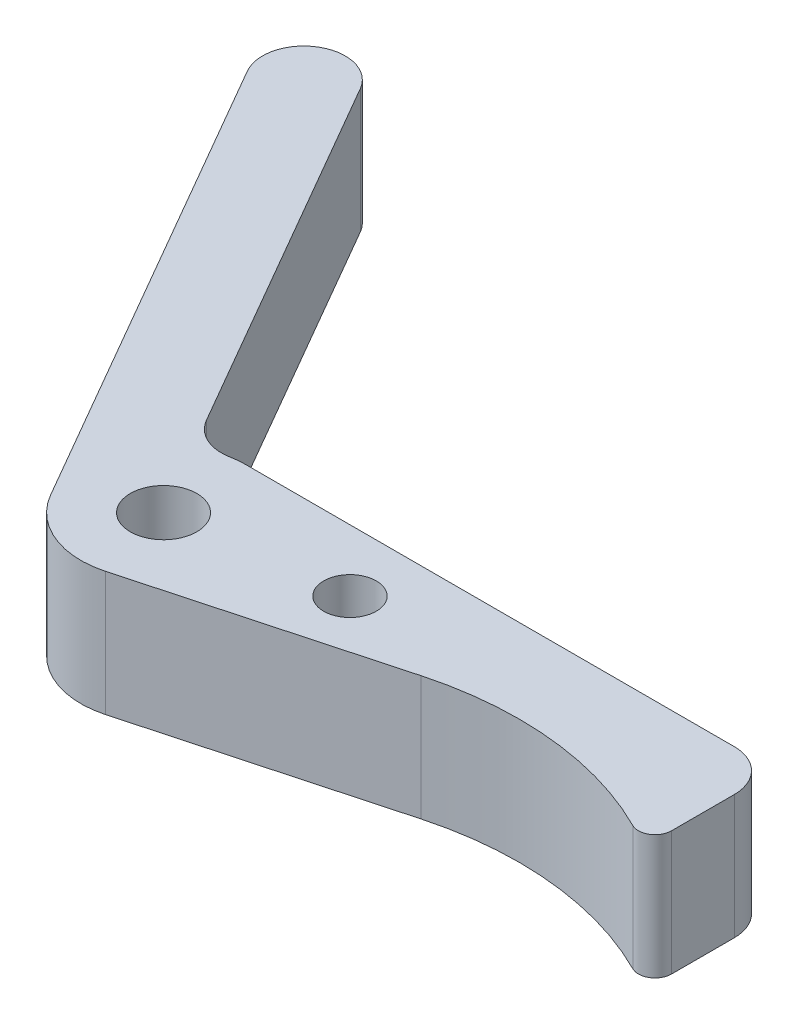
from build123d import *

# Parameters (mm, degrees)
SKETCH1_R              = 6.35
SKETCH1_R_2            = 2.5527
BOSS_EXTRUDE1_DEPTH    = 9.525
FILLET1_R              = 3.175
FILLET2_R              = 1.27
F_10_32_TAPPED_HOLE1_D = 4.0386


with BuildPart() as part:
    # Sketch1 → Boss-Extrude1 (new body)
    # profile 1 of 3: a face of its own
    with BuildSketch(Plane(origin=(0, 0, 0), x_dir=(1, 0, 0), z_dir=(0, 1, 0))):
        Circle(SKETCH1_R)
        with Locations(Location((0, 0, 0), (0, 0, 90))):
            Circle(SKETCH1_R_2, mode=Mode.SUBTRACT)
    # profile 2 of 3: a face of its own
    with BuildSketch(Plane(origin=(0, 0, 0), x_dir=(1, 0, 0), z_dir=(0, 1, 0))):
        with BuildLine():
            Line((40.64, 6.35), (0, 6.35))
            ThreePointArc((0, 6.35), (4.490128061, 4.490128061), (6.35, 0))
            ThreePointArc((6.35, 0), (5.044240229, -3.857219271), (1.663971494, -6.128107283))
            Line((1.663971494, -6.128107283), (20.713971494, -0.955440505))
            ThreePointArc((20.713971494, -0.955440505), (30.971832611, -0.32456486), (40.64, -3.81))
            Line((40.64, -3.81), (40.64, 6.35))
        make_face()
    # profile 3 of 3: a face of its own
    with BuildSketch(Plane(origin=(0, 0, 0), x_dir=(1, 0, 0), z_dir=(0, 1, 0))):
        with BuildLine():
            ThreePointArc((-5.499261314, -3.175), (-6.133628997, 1.643500936), (-3.175, 5.499261314))
            Line((-3.175, 5.499261314), (-22.225, 38.494829198))
            Line((-22.225, 38.494829198), (-27.724261314, 35.319829198))
            Line((-27.724261314, 35.319829198), (-5.499261314, -3.175))
        make_face()
    extrude(amount=BOSS_EXTRUDE1_DEPTH)

    # Fillet1
    fillet1_edges = [part.edges().sort_by_distance(p)[0] for p in [
        (40.64, 4.7625, -6.35),
        (-3.175, 4.7625, -5.499261314),
        (-27.724261314, 4.7625, -35.319829198),
        (-22.225, 4.7625, -38.494829198),
    ]]
    fillet(fillet1_edges, radius=FILLET1_R - 0.0001)  # a hair under: the kernel refuses the full size

    # Fillet2
    fillet2_edges = [part.edges().sort_by_distance(p)[0] for p in [
        (40.64, 4.7625, 3.81),
    ]]
    fillet(fillet2_edges, radius=FILLET2_R)

    # #10-32 Tapped Hole1 (through all)
    with Locations(Plane(origin=(0, 9.525, 0), x_dir=(1, 0, 0), z_dir=(0, 1, 0))):
        with Locations((12.7, 1.609258642)):
            Hole(F_10_32_TAPPED_HOLE1_D / 2)


solid = part.part
